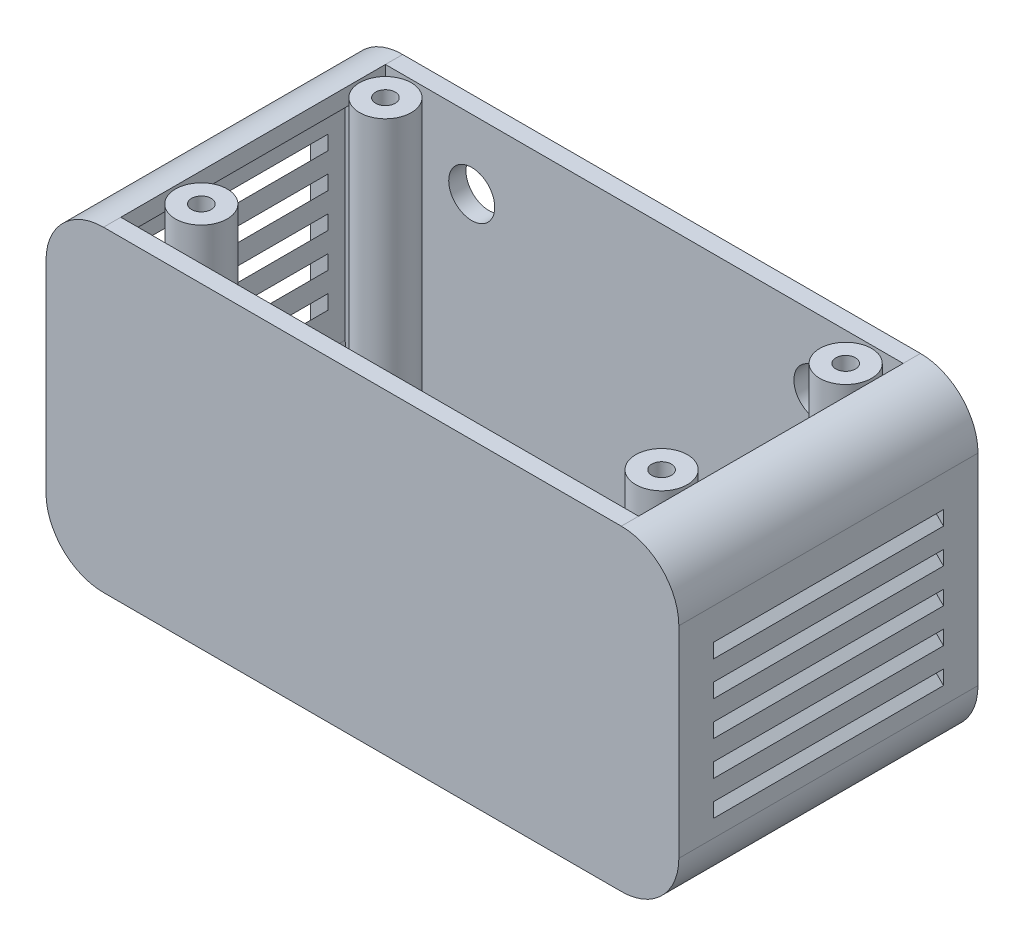
from build123d import *

# Parameters (mm, degrees)
BOSS_EXTRUDE1_DEPTH     = 52
SHELL1_START            = 3
SHELL1_DEPTH            = 46
SKETCH2_R               = 4.5
BOSS_EXTRUDE2_DEPTH     = 52
SKETCH3_R               = 3.25
CUT_EXTRUDE1_DEPTH      = 49
SKETCH4_R               = 1.7
CUT_EXTRUDE2_DEPTH      = 91.166512631
CUT_EXTRUDE3_DEPTH      = 20
CUT_EXTRUDE3_DEPTH_BACK = 20
CUT_EXTRUDE4_DEPTH      = 3.5
SKETCH7_R               = 4
CUT_EXTRUDE5_DEPTH      = 3.5
SKETCH8_W               = 6
SKETCH8_H               = 37
BOSS_EXTRUDE3_DEPTH     = 8
SKETCH9_W               = 1.9
SKETCH9_H               = 33.6
CUT_EXTRUDE6_DEPTH      = 6
SKETCH10_R              = 3
BOSS_EXTRUDE4_DEPTH     = 8


# Read off the part's stored shape, not the designer's step: Shell1
with BuildPart() as part:
    # Sketch1 → Boss-Extrude1 (new body)
    with BuildSketch(Plane.XY):
        with BuildLine():
            Line((-45, -55), (45, -55))
            ThreePointArc((45, -55), (52.071067812, -52.071067812), (55, -45))
            Line((55, -45), (55, -10))
            ThreePointArc((55, -10), (52.071067812, -2.928932188), (45, 0))
            Line((45, 0), (-45, 0))
            ThreePointArc((-45, 0), (-52.071067812, -2.928932188), (-55, -10))
            Line((-55, -10), (-55, -45))
            ThreePointArc((-55, -45), (-52.071067812, -52.071067812), (-45, -55))
        make_face()
    extrude(amount=BOSS_EXTRUDE1_DEPTH)

    # Shell1 outline → Shell1 (cut)
    with BuildSketch(Plane.XY.offset(SHELL1_START)):
        with BuildLine():
            Line((45, -3), (45, 0))
            Line((45, 0), (-45, 0))
            Line((-45, 0), (-45, -3))
            ThreePointArc((-45, -3), (-49.949747468, -5.050252532), (-52, -10))
            Line((-52, -10), (-52, -45))
            ThreePointArc((-52, -45), (-49.949747468, -49.949747468), (-45, -52))
            Line((-45, -52), (45, -52))
            ThreePointArc((45, -52), (49.949747468, -49.949747468), (52, -45))
            Line((52, -45), (52, -10))
            ThreePointArc((52, -10), (49.949747468, -5.050252532), (45, -3))
        make_face()
    extrude(amount=SHELL1_DEPTH, mode=Mode.SUBTRACT)

    # Sketch2 → Boss-Extrude2 (add)
    with BuildSketch(Plane(origin=(0, 0, 0), x_dir=(1, 0, 0), z_dir=(0, 1, 0))):
        with Locations(Location((-40, -8, 0), (0, 0, 270))):
            Circle(SKETCH2_R)
        with Locations(Location((40, -8, 0), (0, 0, 270))):
            Circle(SKETCH2_R)
        with Locations(Location((-40, -40, 0), (0, 0, 270))):
            Circle(SKETCH2_R)
        with Locations(Location((40, -40, 0), (0, 0, 270))):
            Circle(SKETCH2_R)
    extrude(amount=-BOSS_EXTRUDE2_DEPTH)

    # Sketch3 → Cut-Extrude1 (cut)
    with BuildSketch(Plane.XZ.offset(55)):
        with Locations(Location((-40, 8, 0), (0, 0, 270))):
            Circle(SKETCH3_R)
        with Locations(Location((40, 8, 0), (0, 0, 270))):
            Circle(SKETCH3_R)
        with Locations(Location((-40, 40, 0), (0, 0, 270))):
            Circle(SKETCH3_R)
        with Locations(Location((40, 40, 0), (0, 0, 270))):
            Circle(SKETCH3_R)
    extrude(amount=-CUT_EXTRUDE1_DEPTH, mode=Mode.SUBTRACT)

    # Sketch4 → Cut-Extrude2 (cut, through all)
    with BuildSketch(Plane.XZ.offset(6)):
        with Locations(Location((-40, 8, 0), (0, 0, 270))):
            Circle(SKETCH4_R)
        with Locations(Location((40, 8, 0), (0, 0, 270))):
            Circle(SKETCH4_R)
        with Locations(Location((-40, 40, 0), (0, 0, 270))):
            Circle(SKETCH4_R)
        with Locations(Location((40, 40, 0), (0, 0, 270))):
            Circle(SKETCH4_R)
    extrude(amount=-CUT_EXTRUDE2_DEPTH, mode=Mode.SUBTRACT)

    # Sketch5 → Cut-Extrude3 (cut, two sides: drawn at the far end of the back side and taken through both)
    with BuildSketch(Plane.XY.offset(26).offset(-CUT_EXTRUDE3_DEPTH_BACK)):
        Polygon((-51, -14), (-51, -11.5), (-55.5, -16), (-55.5, -18.5), align=None)
        Polygon((51, -14), (51, -11.5), (55.5, -16), (55.5, -18.5), align=None)
        Polygon((-51, -20), (-51, -17.5), (-55.5, -22), (-55.5, -24.5), align=None)
        Polygon((51, -20), (51, -17.5), (55.5, -22), (55.5, -24.5), align=None)
        Polygon((-51, -26), (-51, -23.5), (-55.5, -28), (-55.5, -30.5), align=None)
        Polygon((51, -26), (51, -23.5), (55.5, -28), (55.5, -30.5), align=None)
        Polygon((-51, -32), (-51, -29.5), (-55.5, -34), (-55.5, -36.5), align=None)
        Polygon((51, -32), (51, -29.5), (55.5, -34), (55.5, -36.5), align=None)
        Polygon((-51, -38), (-51, -35.5), (-55.5, -40), (-55.5, -42.5), align=None)
        Polygon((51, -38), (51, -35.5), (55.5, -40), (55.5, -42.5), align=None)
    extrude(amount=CUT_EXTRUDE3_DEPTH + CUT_EXTRUDE3_DEPTH_BACK, mode=Mode.SUBTRACT)

    # Sketch6 → Cut-Extrude4 (cut)
    with BuildSketch(Plane.XZ.offset(55)):
        with BuildLine():
            Line((-34.5, 12), (-34.5, 40))
            ThreePointArc((-34.5, 40), (-33, 41.5), (-31.5, 40))
            Line((-31.5, 40), (-31.5, 12))
            ThreePointArc((-31.5, 12), (-33, 10.5), (-34.5, 12))
        make_face()
        with BuildLine():
            Line((-28.5, 12), (-28.5, 40))
            ThreePointArc((-28.5, 40), (-27, 41.5), (-25.5, 40))
            Line((-25.5, 40), (-25.5, 12))
            ThreePointArc((-25.5, 12), (-27, 10.5), (-28.5, 12))
        make_face()
        with BuildLine():
            Line((-22.5, 12), (-22.5, 40))
            ThreePointArc((-22.5, 40), (-21, 41.5), (-19.5, 40))
            Line((-19.5, 40), (-19.5, 12))
            ThreePointArc((-19.5, 12), (-21, 10.5), (-22.5, 12))
        make_face()
        with BuildLine():
            Line((-16.5, 12), (-16.5, 40))
            ThreePointArc((-16.5, 40), (-15, 41.5), (-13.5, 40))
            Line((-13.5, 40), (-13.5, 12))
            ThreePointArc((-13.5, 12), (-15, 10.5), (-16.5, 12))
        make_face()
        with BuildLine():
            Line((-10.5, 12), (-10.5, 40))
            ThreePointArc((-10.5, 40), (-9, 41.5), (-7.5, 40))
            Line((-7.5, 40), (-7.5, 12))
            ThreePointArc((-7.5, 12), (-9, 10.5), (-10.5, 12))
        make_face()
        with BuildLine():
            Line((-4.5, 12), (-4.5, 40))
            ThreePointArc((-4.5, 40), (-3, 41.5), (-1.5, 40))
            Line((-1.5, 40), (-1.5, 12))
            ThreePointArc((-1.5, 12), (-3, 10.5), (-4.5, 12))
        make_face()
        with BuildLine():
            Line((1.5, 12), (1.5, 40))
            ThreePointArc((1.5, 40), (3, 41.5), (4.5, 40))
            Line((4.5, 40), (4.5, 12))
            ThreePointArc((4.5, 12), (3, 10.5), (1.5, 12))
        make_face()
        with BuildLine():
            Line((7.5, 12), (7.5, 40))
            ThreePointArc((7.5, 40), (9, 41.5), (10.5, 40))
            Line((10.5, 40), (10.5, 12))
            ThreePointArc((10.5, 12), (9, 10.5), (7.5, 12))
        make_face()
        with BuildLine():
            Line((13.5, 12), (13.5, 40))
            ThreePointArc((13.5, 40), (15, 41.5), (16.5, 40))
            Line((16.5, 40), (16.5, 12))
            ThreePointArc((16.5, 12), (15, 10.5), (13.5, 12))
        make_face()
        with BuildLine():
            Line((19.5, 12), (19.5, 40))
            ThreePointArc((19.5, 40), (21, 41.5), (22.5, 40))
            Line((22.5, 40), (22.5, 12))
            ThreePointArc((22.5, 12), (21, 10.5), (19.5, 12))
        make_face()
    extrude(amount=-CUT_EXTRUDE4_DEPTH, mode=Mode.SUBTRACT)

    # Sketch7 → Cut-Extrude5 (cut)
    with BuildSketch(Plane(origin=(0, 0, 0), x_dir=(-1, 0, 0), z_dir=(0, 0, -1))):
        with Locations((30, -12)):
            Circle(SKETCH7_R)
        with Locations((-30, -12)):
            Circle(SKETCH7_R)
    extrude(amount=-CUT_EXTRUDE5_DEPTH, mode=Mode.SUBTRACT)

    # Sketch8 → Boss-Extrude3 (add)
    with BuildSketch(Plane(origin=(0, -52, 0), x_dir=(1, 0, 0), z_dir=(0, 1, 0))):
        with Locations((30, -26)):
            Rectangle(SKETCH8_W, SKETCH8_H)
    extrude(amount=BOSS_EXTRUDE3_DEPTH)

    # Sketch9 → Cut-Extrude6 (cut)
    with BuildSketch(Plane(origin=(0, -44, 0), x_dir=(1, 0, 0), z_dir=(0, 1, 0))):
        with Locations((30, -26)):
            Rectangle(SKETCH9_W, SKETCH9_H)
    extrude(amount=-CUT_EXTRUDE6_DEPTH, mode=Mode.SUBTRACT)

    # Sketch10 → Boss-Extrude4 (add)
    with BuildSketch(Plane(origin=(0, -52, 0), x_dir=(1, 0, 0), z_dir=(0, 1, 0))):
        with Locations(Location((-29, -13, 0), (0, 0, 55.426050329))):
            Circle(SKETCH10_R)
        with Locations(Location((-29, -39, 0), (0, 0, 80.405931773))):
            Circle(SKETCH10_R)
        with Locations(Location((13, -13, 0), (0, 0, 55.426050329))):
            Circle(SKETCH10_R)
        with Locations(Location((13, -39, 0), (0, 0, 80.405931773))):
            Circle(SKETCH10_R)
    extrude(amount=BOSS_EXTRUDE4_DEPTH)


solid = part.part
